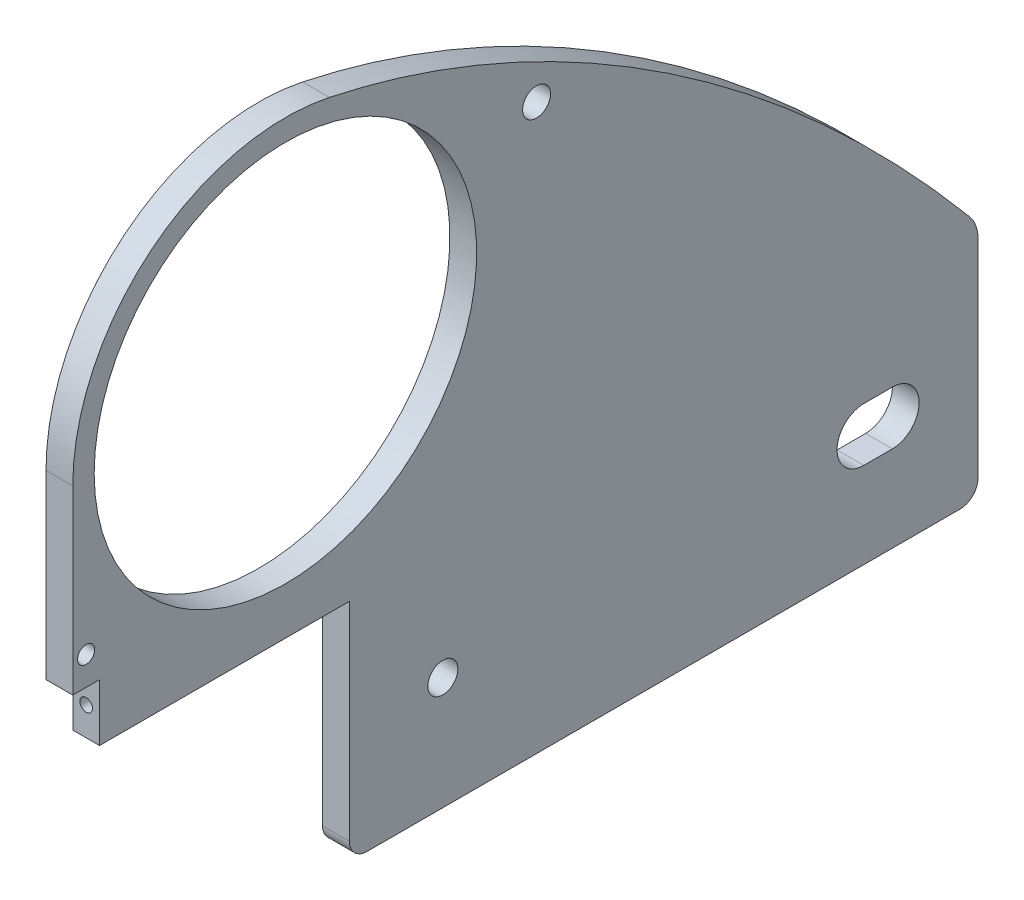
from build123d import *

# Parameters (mm, degrees)
SKETCH1_R           = 1.524
SKETCH1_R_2         = 2.4892
SKETCH1_R_3         = 2.667
SKETCH1_R_4         = 34.04
BOSS_EXTRUDE1_DEPTH = 4.7625
SKETCH2_R           = 1.1303
CUT_EXTRUDE1_DEPTH  = 6.35


with BuildPart() as part:
    # Sketch1 → Boss-Extrude1 (new body)
    with BuildSketch(Plane(origin=(0, 0, 0), x_dir=(0, 0, -1), z_dir=(1, 0, 0))):
        with BuildLine():
            Line((-28.170295117, 0), (77.382795117, 0))
            ThreePointArc((77.382795117, 0), (79.627859148, 0.92993597), (80.557795117, 3.175))
            Line((80.557795117, 3.175), (80.557795117, 40.132))
            ThreePointArc((80.557795117, 40.132), (80.175158576, 42.302961389), (79.073362565, 44.212288398))
            add(Edge.make_bspline(
                [(-34.867281509, 119.579027078), (-0.058341562, 112.208593965), (41.263784204, 89.298575374), (79.073362565, 44.212288398)],
                knots=[0, 0, 0, 0, 1, 1, 1, 1], degree=3))
            ThreePointArc((-34.867281509, 119.579027078), (-66.539067219, 111.95566221), (-80.557795117, 82.55))
            Line((-80.557795117, 82.55), (-80.557795117, 50.292))
            Line((-80.557795117, 50.292), (-75.795295117, 50.292))
            Line((-75.795295117, 50.292), (-75.795295117, 40.132))
            Line((-75.795295117, 40.132), (-31.345295117, 40.132))
            Line((-31.345295117, 40.132), (-31.345295117, 3.175))
            ThreePointArc((-31.345295117, 3.175), (-30.415359148, 0.92993597), (-28.170295117, 0))
        make_face()
        with Locations((-78.176545117, 55.372)):
            Circle(SKETCH1_R, mode=Mode.SUBTRACT)
        with Locations((1.992204883, 100.457)):
            Circle(SKETCH1_R_2, mode=Mode.SUBTRACT)
        with Locations((-14.692204883, 20.066)):
            Circle(SKETCH1_R_3, mode=Mode.SUBTRACT)
        with Locations((-42.707795117, 82.55)):
            Circle(SKETCH1_R_4, mode=Mode.SUBTRACT)
        with BuildLine():
            Line((65.317795117, 15.3035), (60.237795117, 15.3035))
            ThreePointArc((60.237795117, 15.3035), (55.475295117, 20.066), (60.237795117, 24.8285))
            Line((60.237795117, 24.8285), (65.317795117, 24.8285))
            ThreePointArc((65.317795117, 24.8285), (70.080295117, 20.066), (65.317795117, 15.3035))
        make_face(mode=Mode.SUBTRACT)
    extrude(amount=BOSS_EXTRUDE1_DEPTH)

    # Sketch2 → Cut-Extrude1 (cut)
    with BuildSketch(Plane.XY.offset(75.795295117)):
        with Locations((2.38125, 45.212)):
            Circle(SKETCH2_R)
    extrude(amount=-CUT_EXTRUDE1_DEPTH, mode=Mode.SUBTRACT)


solid = part.part
